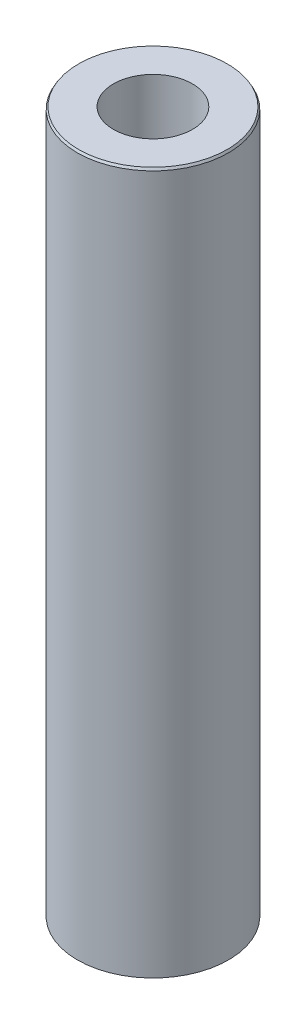
from build123d import *
from OCP.BRepFilletAPI import BRepFilletAPI_MakeChamfer

# Parameters (mm, degrees)
SKETCH1_R           = 12.5
BOSS_EXTRUDE1_DEPTH = 116.207026086
SKETCH2_R           = 6.537708415
CUT_EXTRUDE1_DEPTH  = 118.543919076
CHAMFER1_SIZE       = 0.37110181
CHAMFER1_SIZE2      = 0.21425573


with BuildPart() as part:
    # Sketch1 → Boss-Extrude1 (new body)
    with BuildSketch(Plane(origin=(0, 0, 0), x_dir=(1, 0, 0), z_dir=(0, 1, 0))):
        Circle(SKETCH1_R)
    extrude(amount=BOSS_EXTRUDE1_DEPTH)

    # Sketch2 → Cut-Extrude1 (cut, through all)
    with BuildSketch(Plane(origin=(0, 0, 0), x_dir=(1, 0, 0), z_dir=(0, 1, 0))):
        Circle(SKETCH2_R)
    extrude(amount=CUT_EXTRUDE1_DEPTH, mode=Mode.SUBTRACT)

    # Chamfer1: one chamfer whose edges measure the first distance from different faces: ONE call of the kernel's chamfer builder (chamfer() names one face for all edges)
    chamfer1_edges_1 = [part.edges().sort_by_distance(p)[0] for p in [
        (-12.5, 116.207026086, 0),
    ]]
    chamfer1_side_1 = [part.faces().sort_by_distance(p)[0] for p in [
        (-12.5, 58.103513043, 0),
    ]]
    chamfer1_edges_2 = [part.edges().sort_by_distance(p)[0] for p in [
        (-12.5, 0, 0),
    ]]
    chamfer1_side_2 = [part.faces().sort_by_distance(p)[0] for p in [
        (-12.146446609, 0, 0),
    ]]
    chamfer1 = BRepFilletAPI_MakeChamfer(part.part.solid().wrapped)
    for e in chamfer1_edges_1:
        chamfer1.Add(CHAMFER1_SIZE, CHAMFER1_SIZE2, e.wrapped, chamfer1_side_1[0].wrapped)  # the first distance lies on this face
    for e in chamfer1_edges_2:
        chamfer1.Add(CHAMFER1_SIZE, CHAMFER1_SIZE2, e.wrapped, chamfer1_side_2[0].wrapped)  # the first distance lies on this face
    add(Compound.cast(chamfer1.Shape()), mode=Mode.REPLACE)


solid = part.part
